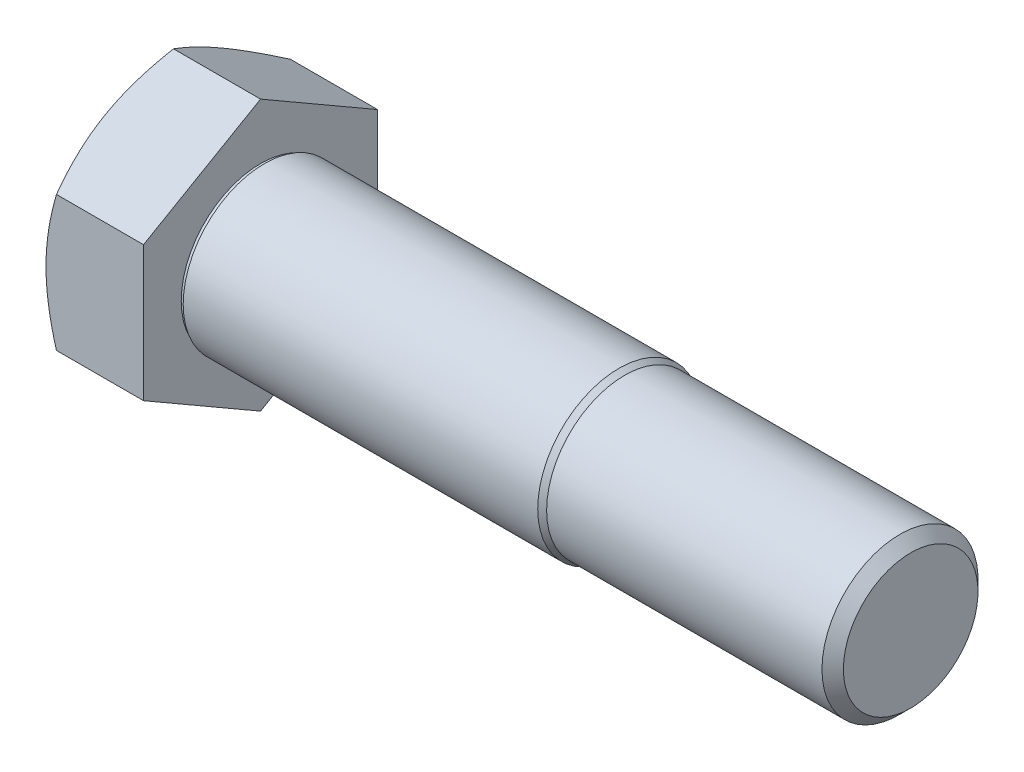
from build123d import *

# Parameters (mm, degrees)
BASEHEAD_DEPTH = 15


with BuildPart() as part:
    # BaseHeadSke → BaseHead (new body)
    with BuildSketch(Plane(origin=(0, 0, 0), x_dir=(0, 0, -1), z_dir=(1, 0, 0))):
        Polygon((0, 20.784609691), (-18, 10.392304845), (-18, -10.392304845), (0, -20.784609691), (18, -10.392304845), (18, 10.392304845), align=None)
    extrude(amount=BASEHEAD_DEPTH)

    # HeadChamferSke → HeadChamfer (revolve, cut)
    with BuildSketch(Plane.XY):
        Polygon((0, 20.784609691), (0, 18), (1.607695155, 20.784609691), align=None)
    revolve(axis=Axis((0, 0, 0), (1, 0, 0)), mode=Mode.SUBTRACT)

    # BodySke → BaseBody (revolve)
    with BuildSketch(Plane.XY):
        Polygon((15, 12.2), (15.6, 12.2), (15.6, 12.5), (70.133974596, 12.5), (71, 12), (113.352, 12), (115, 10.352), (115, 0), (15, 0), align=None)
    revolve(axis=Axis((0, 0, 0), (1, 0, 0)))


solid = part.part
